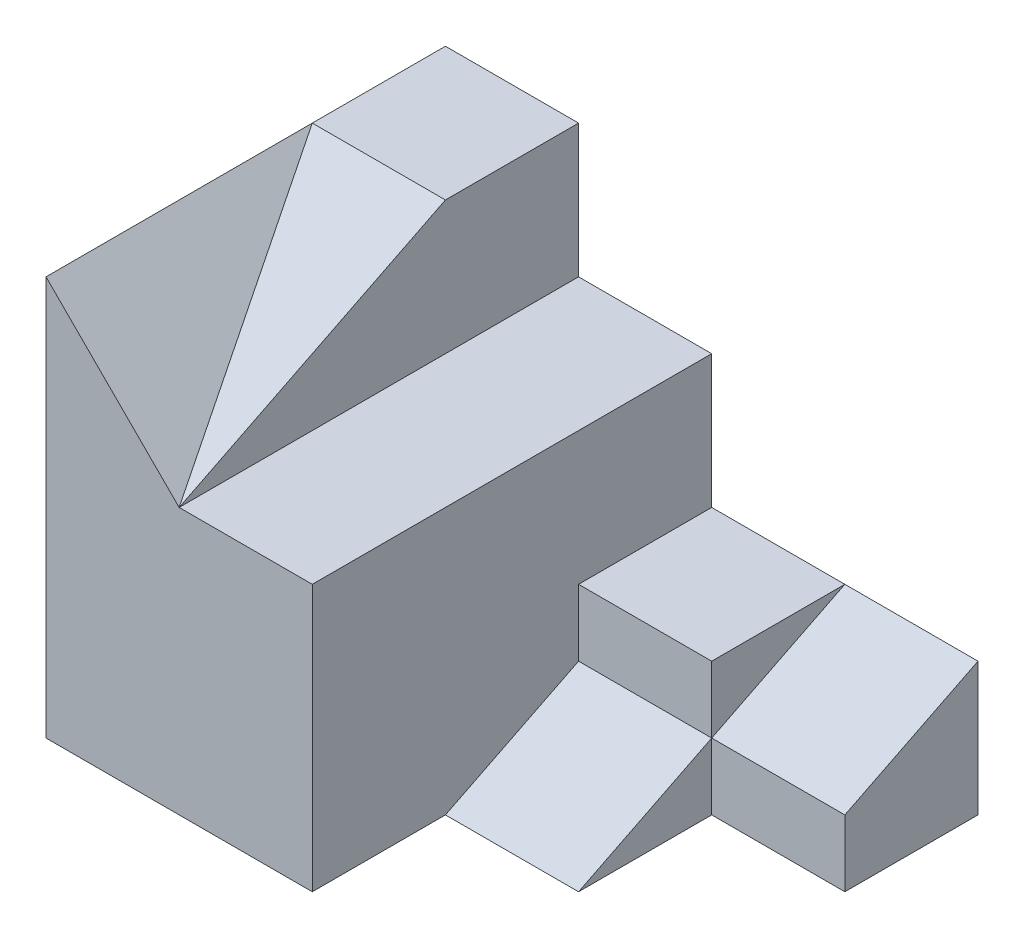
from build123d import *

# Parameters (mm, degrees)
SKETCH_1_W           = 40
SKETCH_1_H           = 30
EXTRUDE_1_DEPTH      = 30
SKETCH_46_W          = 20
SKETCH_46_H          = 10
CUT_EXTRUDE_32_DEPTH = 59.309518948
CUT_EXTRUDE_33_DEPTH = 59.309518948
CUT_EXTRUDE_34_DEPTH = 20
EXTRUDE_2_DEPTH      = 10
CUT_EXTRUDE_35_DEPTH = 20
SKETCH_54_W          = 10
SKETCH_54_H          = 5
EXTRUDE_3_DEPTH      = 10


with BuildPart() as part:
    # 草圖1 → 填料-伸1 (new body)
    with BuildSketch(Plane.XY):
        with Locations((20, 15)):
            Rectangle(SKETCH_1_W, SKETCH_1_H)
    extrude(amount=-EXTRUDE_1_DEPTH)

    # 草圖46 → 除料-伸長32 (cut, through all)
    with BuildSketch(Plane.XY):
        Polygon((40, 30), (10, 30), (10, 20), (20, 20), (40, 20), align=None)
        with Locations((30, 15)):
            Rectangle(SKETCH_46_W, SKETCH_46_H)
    extrude(amount=-CUT_EXTRUDE_32_DEPTH, mode=Mode.SUBTRACT)

    # 草圖47 → 除料-伸長33 (cut, through all)
    with BuildSketch(Plane(origin=(0, 30, 0), x_dir=(1, 0, 0), z_dir=(0, 1, 0))):
        Polygon((20, 0), (20, 10), (30, 10), (30, 20), (40, 20), (40, 0), align=None)
    extrude(amount=-CUT_EXTRUDE_33_DEPTH, mode=Mode.SUBTRACT)

    # 草圖48 → 除料-伸長34 (cut)
    with BuildSketch(Plane.XY):
        Polygon((0, 30), (10, 20), (10, 30), align=None)
    extrude(amount=-CUT_EXTRUDE_34_DEPTH, mode=Mode.SUBTRACT)

    # 填料-伸長2: read off the stored shape, not the designer's step
    # 填料-伸長2 outline → 填料-伸長2 (add)
    with BuildSketch(Plane.YZ):
        Polygon((20, -30), (30, -30), (30, -20), (20, 0), align=None)
    extrude(amount=EXTRUDE_2_DEPTH)

    # 草圖52 → 除料-伸長35 (cut)
    with BuildSketch(Plane(origin=(40, 0, 0), x_dir=(0, 0, -1), z_dir=(1, 0, 0))):
        Polygon((20, 10), (20, 5), (30, 10), align=None)
        Polygon((10, 10), (10, 0), (20, 5), (20, 10), align=None)
    extrude(amount=-CUT_EXTRUDE_35_DEPTH, mode=Mode.SUBTRACT)

    # 草圖54 → 填料-伸長3 (add)
    with BuildSketch(Plane(origin=(20, 0, 0), x_dir=(0, 0, -1), z_dir=(1, 0, 0))):
        with Locations((25, 7.5)):
            Rectangle(SKETCH_54_W, SKETCH_54_H)
    extrude(amount=EXTRUDE_3_DEPTH)


solid = part.part
